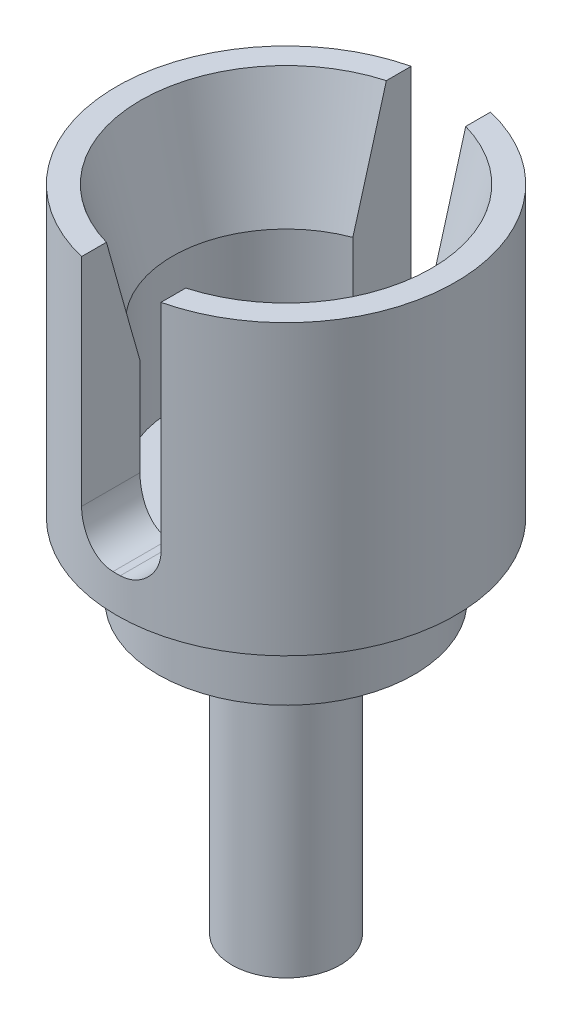
from build123d import *

# Parameters (mm, degrees)
SKETCH1_R               = 1.5
BOSS_EXTRUDE1_DEPTH     = 8
SKETCH1_3_R             = 3.55
BOSS_EXTRUDE2_DEPTH     = 2
SKETCH2_R               = 4.7
BOSS_EXTRUDE3_DEPTH     = 8
CUT_EXTRUDE1_DEPTH      = 20.188017094
CUT_EXTRUDE1_DEPTH_BACK = 7
SKETCH3_R               = 3.15
CHAMFER1_SIZE           = 3.3
CHAMFER1_SIZE2          = 0.884232335
CUT_EXTRUDE2_DEPTH      = 13.007497658
CUT_EXTRUDE2_DEPTH_BACK = 13.007497658
SKETCH4_W               = 2.2
SKETCH4_H               = 7
FILLET1_R               = 1


with BuildPart() as part:
    # Sketch1 → Boss-Extrude1 (new body)
    with BuildSketch(Plane(origin=(0, 0, 0), x_dir=(1, 0, 0), z_dir=(0, 1, 0))):
        Circle(SKETCH1_R)
    extrude(amount=-BOSS_EXTRUDE1_DEPTH)

    # Sketch1<3> → Boss-Extrude2 (add)
    with BuildSketch(Plane(origin=(0, 0, 0), x_dir=(1, 0, 0), z_dir=(0, 1, 0))):
        Circle(SKETCH1_3_R)
    extrude(amount=BOSS_EXTRUDE2_DEPTH)

    # Sketch2 → Boss-Extrude3 (add)
    with BuildSketch(Plane(origin=(0, 2, 0), x_dir=(1, 0, 0), z_dir=(0, 1, 0))):
        Circle(SKETCH2_R)
    extrude(amount=BOSS_EXTRUDE3_DEPTH)

    # Sketch3 → Cut-Extrude1 (cut, two sides: drawn at the far end of the back side and taken through both)
    with BuildSketch(Plane(origin=(0, 10, 0), x_dir=(1, 0, 0), z_dir=(0, 1, 0)).offset(-CUT_EXTRUDE1_DEPTH_BACK)):
        Circle(SKETCH3_R)
    extrude(amount=CUT_EXTRUDE1_DEPTH + CUT_EXTRUDE1_DEPTH_BACK, mode=Mode.SUBTRACT)

    # Chamfer1
    chamfer1_edges = [part.edges().sort_by_distance(p)[0] for p in [
        (-3.15, 10, 0),
    ]]
    chamfer1_side = [part.faces().sort_by_distance(p)[0] for p in [
        (-3.15, 6.5, 0),
    ]]
    chamfer(chamfer1_edges, length=CHAMFER1_SIZE, length2=CHAMFER1_SIZE2, reference=chamfer1_side[0])

    # Sketch4 → Cut-Extrude2 (cut, two sides: drawn at the far end of the back side and taken through both)
    with BuildSketch(Plane.XY.offset(-CUT_EXTRUDE2_DEPTH_BACK)):
        with Locations((0, 6.5)):
            Rectangle(SKETCH4_W, SKETCH4_H)
    extrude(amount=CUT_EXTRUDE2_DEPTH + CUT_EXTRUDE2_DEPTH_BACK, mode=Mode.SUBTRACT)

    # Fillet1
    fillet1_edges = [part.edges().sort_by_distance(p)[0] for p in [
        (1.1, 3, -3.760579146),
        (-1.1, 3, -3.760579146),
        (1.1, 3, 3.760579146),
        (-1.1, 3, 3.760579146),
    ]]
    fillet(fillet1_edges, radius=FILLET1_R)


solid = part.part
